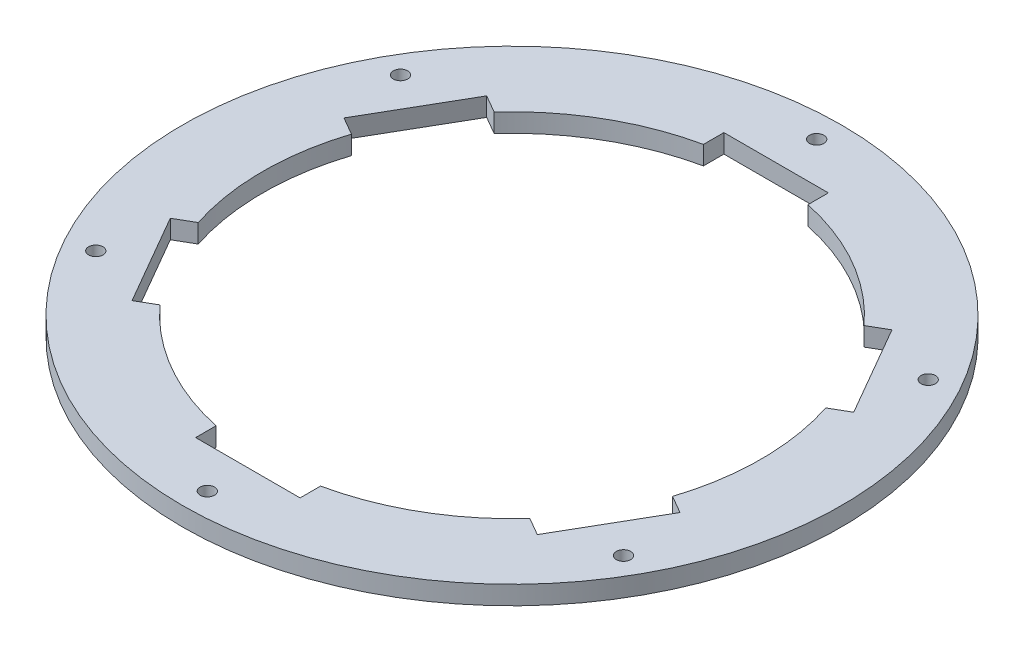
from build123d import *

# Parameters (mm, degrees)
SKETCH1_R             = 84.1375
SKETCH1_R_2           = 1.8288
BOSS_EXTRUDE1_DEPTH   = 4.7625
CIRPATTERN1_OUTLINE_R = 1.8288
CIRPATTERN1_DEPTH     = 4.7625
SKETCH4_R             = 5.588
CUT_EXTRUDE1_DEPTH    = 1.905
CIRPATTERN2_COUNT     = 3


# Read off the part's stored shape, not the designer's step: CirPattern1
with BuildPart() as part:
    # Sketch1 → Boss-Extrude1 (new body)
    with BuildSketch(Plane(origin=(0, 0, 0), x_dir=(1, 0, 0), z_dir=(0, 1, 0))):
        with Locations(Location((0, 0, 0), (0, 0, 90))):
            Circle(SKETCH1_R)
        with BuildLine():
            ThreePointArc((-13.335, -62.213928537), (0, 63.627), (13.335, -62.213928537))
            Line((13.335, -62.213928537), (13.335, -67.437))
            Line((13.335, -67.437), (-13.335, -67.437))
            Line((-13.335, -67.437), (-13.335, -62.213928537))
        make_face(mode=Mode.SUBTRACT)
        with Locations(Location((0, -77.7875, 0), (0, 0, 90))):
            Circle(SKETCH1_R_2, mode=Mode.SUBTRACT)
    extrude(amount=BOSS_EXTRUDE1_DEPTH)

    # CirPattern1 outline → CirPattern1 (cut)
    with BuildSketch(Plane(origin=(0, 0, 0), x_dir=(1, 0, 0), z_dir=(0, 1, 0))):
        with BuildLine():
            Line((65.069655155, -22.170051241), (60.546342582, -19.558515509))
            ThreePointArc((60.546342582, -19.558515509), (55.102598367, -31.8135), (47.211342582, -42.655413028))
            Line((47.211342582, -42.655413028), (51.734655155, -45.266948759))
            Line((51.734655155, -45.266948759), (65.069655155, -22.170051241))
        make_face()
        with BuildLine():
            Line((51.734655155, 45.266948759), (47.211342582, 42.655413028))
            ThreePointArc((47.211342582, 42.655413028), (55.102598367, 31.8135), (60.546342582, 19.558515509))
            Line((60.546342582, 19.558515509), (65.069655155, 22.170051241))
            Line((65.069655155, 22.170051241), (51.734655155, 45.266948759))
        make_face()
        with BuildLine():
            Line((-13.335, 67.437), (-13.335, 62.213928537))
            ThreePointArc((-13.335, 62.213928537), (0, 63.627), (13.335, 62.213928537))
            Line((13.335, 62.213928537), (13.335, 67.437))
            Line((13.335, 67.437), (-13.335, 67.437))
        make_face()
        with BuildLine():
            Line((-65.069655155, 22.170051241), (-60.546342582, 19.558515509))
            ThreePointArc((-60.546342582, 19.558515509), (-55.102598367, 31.8135), (-47.211342582, 42.655413028))
            Line((-47.211342582, 42.655413028), (-51.734655155, 45.266948759))
            Line((-51.734655155, 45.266948759), (-65.069655155, 22.170051241))
        make_face()
        with BuildLine():
            Line((-65.069655155, -22.170051241), (-51.734655155, -45.266948759))
            Line((-51.734655155, -45.266948759), (-47.211342582, -42.655413028))
            ThreePointArc((-47.211342582, -42.655413028), (-55.102598367, -31.8135), (-60.546342582, -19.558515509))
            Line((-60.546342582, -19.558515509), (-65.069655155, -22.170051241))
        make_face()
        with Locations((-67.365951097, -38.89375)):
            Circle(CIRPATTERN1_OUTLINE_R)
        with Locations((-67.365951097, 38.89375)):
            Circle(CIRPATTERN1_OUTLINE_R)
        with Locations((0, 77.7875)):
            Circle(CIRPATTERN1_OUTLINE_R)
        with Locations((67.365951097, 38.89375)):
            Circle(CIRPATTERN1_OUTLINE_R)
        with Locations((67.365951097, -38.89375)):
            Circle(CIRPATTERN1_OUTLINE_R)
    extrude(amount=CIRPATTERN1_DEPTH, mode=Mode.SUBTRACT)

    # Sketch4 → Cut-Extrude1 (cut)
    with BuildSketch(Plane.XZ):
        with Locations(Location((35.40125, -61.316763651, 0), (0, 0, 270))):
            Circle(SKETCH4_R)
    cut_extrude1 = extrude(amount=-CUT_EXTRUDE1_DEPTH, mode=Mode.SUBTRACT)

    # CirPattern2: Cut-Extrude1 ×3 about axis
    cirpattern2_axis = Axis((0, 0, 0), (0, 1, 0))
    for i in range(1, CIRPATTERN2_COUNT):
        add(cut_extrude1.rotate(cirpattern2_axis, i * 360 / CIRPATTERN2_COUNT), mode=Mode.SUBTRACT)


solid = part.part
